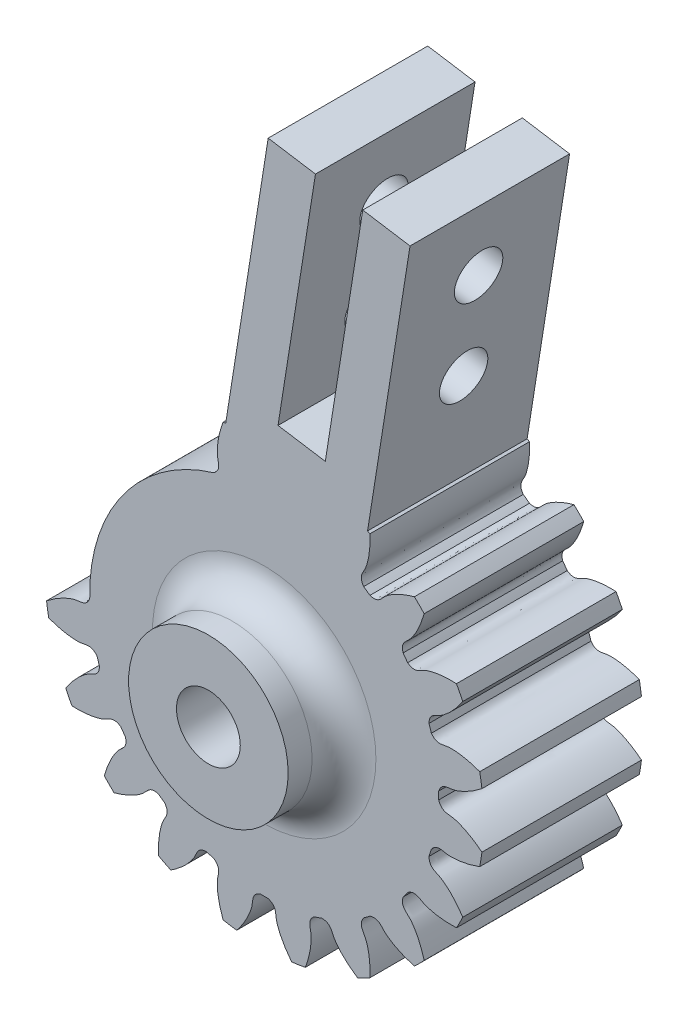
from build123d import *

# Parameters (mm, degrees)
SKETCH_1_R               = 13.75
EXTRUDE_1_DEPTH          = 10
CUT_EXTRUDE_1_DEPTH      = 22.866069606
PATTERN_CIRCULAR_1_COUNT = 20
EXTRUDE_2_DEPTH          = 5
EXTRUDE_2_DEPTH_BACK     = 15
CUT_EXTRUDE_3_DEPTH      = 10
CUT_EXTRUDE_3_DEPTH_BACK = 32
SKETCH_7_W               = 5
SKETCH_7_H               = 32
CUT_EXTRUDE_START        = -22
CUT_EXTRUDE_4_DEPTH      = 22
FILLET_2_R               = 2
FILLET_3_R               = 3
SKETCH_16_R              = 2
CUT_EXTRUDE_5_DEPTH      = 16.5
EXTRUDE_START            = 3.5
SKETCH_18_R              = 5
SKETCH_18_R_2            = 2
EXTRUDE_4_DEPTH          = 3.5
SKETCH_19_R              = 8
CUT_EXTRUDE_7_DEPTH      = 3
FILLET_4_R               = 2
CUT_EXTRUDE_8_DEPTH      = 10
CUT_EXTRUDE_9_DEPTH      = 36
CUT_EXTRUDE_9_DEPTH_BACK = 22
SKETCH_22_R              = 1.5
CUT_EXTRUDE_10_DEPTH     = 10


with BuildPart() as part:
    # 草图1 → 凸台-拉伸1 (new body)
    with BuildSketch(Plane.XY):
        Circle(SKETCH_1_R)
    extrude(amount=EXTRUDE_1_DEPTH)

    # 草图2 → 切除-拉伸1 (cut, through all)
    with BuildSketch(Plane.XY):
        with BuildLine():
            ThreePointArc((0.241645751, 10.934830295), (0, 10.9375), (-0.241645751, 10.934830295))
            add(Edge.make_bspline(
                [(-0.241645751, 10.934830295), (-0.763986756, 11.11684439), (-0.696355124, 11.483892124), (-0.766121321, 11.837511753), (-0.773615233, 11.871945767), (-0.782888612, 11.910793269), (-0.794115121, 11.953996045), (-0.807473925, 12.001489371), (-0.823140069, 12.053203535), (-0.841287339, 12.109063416), (-0.862087187, 12.168988684), (-0.885708875, 12.232893806), (-0.912319248, 12.300688126), (-0.942082628, 12.372275913), (-0.975160664, 12.447556439), (-1.011712206, 12.526424039), (-1.051893167, 12.608768189), (-1.095856396, 12.694473577), (-1.143751548, 12.783420187), (-1.195724957, 12.87548338), (-1.251919512, 12.970533976), (-1.312474533, 13.068438347), (-1.377525652, 13.169058507), (-1.447204695, 13.272252205), (-1.521639564, 13.377873025), (-1.600954126, 13.485770488), (-1.685268101, 13.595790151), (-1.774696952, 13.707773716), (-1.869351783, 13.821559139), (-1.969339231, 13.936980743), (-2.074761371, 14.053869328), (-2.185715611, 14.172052294), (-2.302294605, 14.291353753), (-2.424586158, 14.411594659), (-2.552673133, 14.532592924), (-2.686633373, 14.654163553), (-2.826539612, 14.776118764), (-2.972459398, 14.898268124), (-3.124455015, 15.020418683), (-3.282583418, 15.142375102), (-3.446896124, 15.2639398), (-3.676841988, 15.427049835), (-3.854915516, 15.545415751), (-3.976447477, 15.622814825)],
                knots=[0, 0, 0, 0, 0.165916003, 0.170905922, 0.176663519, 0.183188797, 0.190481754, 0.198542391, 0.207370708, 0.216966704, 0.22733038, 0.238461736, 0.250360771, 0.263027487, 0.276461881, 0.290663956, 0.30563371, 0.321371144, 0.337876258, 0.355149051, 0.373189524, 0.391997677, 0.411573509, 0.431917021, 0.453028213, 0.474907084, 0.497553636, 0.520967867, 0.545149777, 0.570099367, 0.595816637, 0.622301587, 0.649554216, 0.677574526, 0.706362514, 0.735918183, 0.766241531, 0.797332559, 0.829191267, 0.861817654, 0.895211721, 0.929373468, 1, 1, 1, 1], degree=3))
            ThreePointArc((-3.976447477, 15.622814825), (0, 16.120932901), (3.976447477, 15.622814825))
            add(Edge.make_bspline(
                [(0.241645751, 10.934830295), (0.763986756, 11.11684439), (0.696355124, 11.483892124), (0.766121321, 11.837511753), (0.773615233, 11.871945767), (0.782888612, 11.910793269), (0.794115121, 11.953996045), (0.807473925, 12.001489371), (0.823140069, 12.053203535), (0.841287339, 12.109063416), (0.862087187, 12.168988684), (0.885708875, 12.232893806), (0.912319248, 12.300688126), (0.942082628, 12.372275913), (0.975160664, 12.447556439), (1.011712206, 12.526424039), (1.051893167, 12.608768189), (1.095856396, 12.694473577), (1.143751548, 12.783420187), (1.195724957, 12.87548338), (1.251919512, 12.970533976), (1.312474533, 13.068438347), (1.377525652, 13.169058507), (1.447204695, 13.272252205), (1.521639564, 13.377873025), (1.600954126, 13.485770488), (1.685268101, 13.595790151), (1.774696952, 13.707773716), (1.869351783, 13.821559139), (1.969339231, 13.936980743), (2.074761371, 14.053869328), (2.185715611, 14.172052294), (2.302294605, 14.291353753), (2.424586158, 14.411594659), (2.552673133, 14.532592924), (2.686633373, 14.654163553), (2.826539612, 14.776118764), (2.972459398, 14.898268124), (3.124455015, 15.020418683), (3.282583418, 15.142375102), (3.446896124, 15.2639398), (3.676841988, 15.427049835), (3.854915516, 15.545415751), (3.976447477, 15.622814825)],
                knots=[0, 0, 0, 0, 0.165916003, 0.170905922, 0.176663519, 0.183188797, 0.190481754, 0.198542391, 0.207370708, 0.216966704, 0.22733038, 0.238461736, 0.250360771, 0.263027487, 0.276461881, 0.290663956, 0.30563371, 0.321371144, 0.337876258, 0.355149051, 0.373189524, 0.391997677, 0.411573509, 0.431917021, 0.453028213, 0.474907084, 0.497553636, 0.520967867, 0.545149777, 0.570099367, 0.595816637, 0.622301587, 0.649554216, 0.677574526, 0.706362514, 0.735918183, 0.766241531, 0.797332559, 0.829191267, 0.861817654, 0.895211721, 0.929373468, 1, 1, 1, 1], degree=3))
        make_face()
    cut_extrude_1 = extrude(amount=CUT_EXTRUDE_1_DEPTH, mode=Mode.SUBTRACT)

    # 阵列(圆周)1: 切除-拉伸1 ×20 about axis
    pattern_circular_1_axis = Axis((0, 0, -1.5), (0, 0, 1))
    for i in range(1, PATTERN_CIRCULAR_1_COUNT):
        add(cut_extrude_1.rotate(pattern_circular_1_axis, i * 360 / PATTERN_CIRCULAR_1_COUNT), mode=Mode.SUBTRACT)

    # 草图6 → 凸台-拉伸2 (add, two sides: drawn at the far end of the back side and taken through both)
    with BuildSketch(Plane(origin=(0, 0, 0), x_dir=(-1, 0, 0), z_dir=(0, 0, -1)).offset(-EXTRUDE_2_DEPTH_BACK)):
        with BuildLine():
            Line((-4.444597533, -0.703955093), (4.444597533, 0.703955093))
            Line((4.444597533, 0.703955093), (-1.123309149, 35.858334335))
            ThreePointArc((-1.123309149, 35.858334335), (6.18175463, 61.653569146), (-11.311209389, 81.969924763))
            Line((-11.311209389, 81.969924763), (-15.719831619, 70.4850712))
            Line((-15.719831619, 70.4850712), (-10.012504214, 34.45042415))
            Line((-10.012504214, 34.45042415), (-4.444597533, -0.703955093))
        make_face()
    extrude(amount=EXTRUDE_2_DEPTH + EXTRUDE_2_DEPTH_BACK)

    # 草图7 → 切除-拉伸3 (cut, two sides: drawn at the far end of the back side and taken through both)
    with BuildSketch(Plane(origin=(4.444597533, -0.703955093, 0), x_dir=(0, 0, -1), z_dir=(0.9876883405951377, -0.15643446504023123, 0)).offset(-CUT_EXTRUDE_3_DEPTH_BACK)):
        with Locations((2.5, 16)):
            Rectangle(SKETCH_7_W, SKETCH_7_H)
        with Locations((-12.5, 16)):
            Rectangle(SKETCH_7_W, SKETCH_7_H)
    extrude(amount=CUT_EXTRUDE_3_DEPTH + CUT_EXTRUDE_3_DEPTH_BACK, mode=Mode.SUBTRACT)

    # 草图13 → 切除-旋转2 (revolve, cut)
    with BuildSketch(Plane(origin=(12.346104257, -1.955430813, 0), x_dir=(0, 0, 1), z_dir=(-0.9876883405951388, 0.1564344650402244, 0))):
        with BuildLine():
            Line((5, 82.653118449), (5, 34.653118449))
            ThreePointArc((5, 34.653118449), (29, 58.653118449), (5, 82.653118449))
        make_face()
    revolve(axis=Axis((12.41385891, -1.527644771, 5), (0.1564344650402244, 0.9876883405951388, 0)), mode=Mode.SUBTRACT)

    # 草图12 → 切除-拉伸4 (cut)
    with BuildSketch(Plane(origin=(0, 0, -5), x_dir=(-1, 0, 0), z_dir=(0, 0, -1)).offset(CUT_EXTRUDE_START)):
        with BuildLine():
            Line((-11.311209389, 81.969924763), (-11.670273789, 81.03453002))
            ThreePointArc((-11.670273789, 81.03453002), (1.044926137, 71.010674644), (5.846281188, 55.547784376))
            ThreePointArc((5.846281188, 55.547784376), (3.991334875, 45.656412233), (-1.321428913, 37.109213298))
            Line((-1.321428913, 37.109213298), (-1.123309149, 35.858334335))
            ThreePointArc((-1.123309149, 35.858334335), (4.779753161, 44.926816989), (6.848224584, 55.547784376))
            ThreePointArc((6.848224584, 55.547784376), (1.87065393, 71.578181633), (-11.311209389, 81.969924763))
        make_face()
    extrude(amount=CUT_EXTRUDE_4_DEPTH, mode=Mode.SUBTRACT)

    # 圆角2
    fillet_2_edges = [part.edges().sort_by_distance(p)[0] for p in [
        (5.005902881, 31.606026899, 10),
        (5.005902881, 31.606026899, 15),
        (5.005902881, 31.606026899, 0),
        (5.005902881, 31.606026899, -5),
    ]]
    fillet(fillet_2_edges, radius=FILLET_2_R)

    # 圆角3
    fillet_3_edges = [part.edges().sort_by_distance(p)[0] for p in [
        (-5.118751176, 61.808282659, 15),
        (-5.118751176, 61.808282659, -5),
    ]]
    fillet(fillet_3_edges, radius=FILLET_3_R)

    # 草图16 → 切除-拉伸5 (cut)
    with BuildSketch(Plane.XY.offset(10)):
        Circle(SKETCH_16_R)
    extrude(amount=-CUT_EXTRUDE_5_DEPTH, mode=Mode.SUBTRACT)

    # 草图18 → 凸台-拉伸4 (add)
    with BuildSketch(Plane.XY.offset(10).offset(EXTRUDE_START)):
        Circle(SKETCH_18_R)
        Circle(SKETCH_18_R_2, mode=Mode.SUBTRACT)
    extrude(amount=-EXTRUDE_4_DEPTH)

    # 草图19 → 切除-拉伸7 (cut)
    with BuildSketch(Plane(origin=(0, 0, 0), x_dir=(-1, 0, 0), z_dir=(0, 0, -1))):
        Circle(SKETCH_19_R)
    extrude(amount=-CUT_EXTRUDE_7_DEPTH, mode=Mode.SUBTRACT)

    # 圆角4
    fillet_4_edges = [part.edges().sort_by_distance(p)[0] for p in [
        (-5, 0, 10),
    ]]
    fillet(fillet_4_edges, radius=FILLET_4_R)

    # 草图20 → 切除-拉伸8 (cut)
    with BuildSketch(Plane(origin=(0, 0, 0), x_dir=(-1, 0, 0), z_dir=(0, 0, -1))):
        with BuildLine():
            Line((5.774187452, 16.519950341), (3.608867158, 10.324968963))
            ThreePointArc((3.608867158, 10.324968963), (8.919105639, 6.330755157), (10.9375, 0))
            ThreePointArc((10.9375, 0), (10.936832553, -0.120830249), (10.934830295, -0.241645751))
            Line((10.934830295, -0.241645751), (17.498331559, -0.241645751))
            ThreePointArc((17.498331559, -0.241645751), (17.499582885, -0.120825755), (17.5, 0))
            ThreePointArc((17.5, 0), (14.270569022, 10.129208251), (5.774187452, 16.519950341))
        make_face()
    extrude(amount=-CUT_EXTRUDE_8_DEPTH, mode=Mode.SUBTRACT)

    # 草图21 → 切除-拉伸9 (cut, two sides: drawn at the far end of the back side and taken through both)
    with BuildSketch(Plane(origin=(0, 0, 0), x_dir=(-1, 0, 0), z_dir=(0, 0, -1)).offset(-CUT_EXTRUDE_9_DEPTH_BACK)):
        Polygon((-3.828049486, 14.580673411), (-0.864984465, 15.049976806), (-3.21150144, 29.865301915), (16.542265372, 32.993991216), (7.332752624, 91.140566278), (-13.923197078, 87.77395458), (-35.137846022, 84.413884281), (-25.928333274, 26.267309219), (-6.174566462, 29.39599852), align=None)
    extrude(amount=CUT_EXTRUDE_9_DEPTH + CUT_EXTRUDE_9_DEPTH_BACK, mode=Mode.SUBTRACT)

    # 草图22 → 切除-拉伸10 (cut)
    with BuildSketch(Plane(origin=(4.444597533, -0.703955093, 0), x_dir=(0, 0, -1), z_dir=(0.9876883405951378, -0.15643446504023117, 0))):
        with Locations((-5, 25.5)):
            Circle(SKETCH_22_R)
        with Locations((-5, 19.5)):
            Circle(SKETCH_22_R)
    extrude(amount=-CUT_EXTRUDE_10_DEPTH, mode=Mode.SUBTRACT)


solid = part.part
